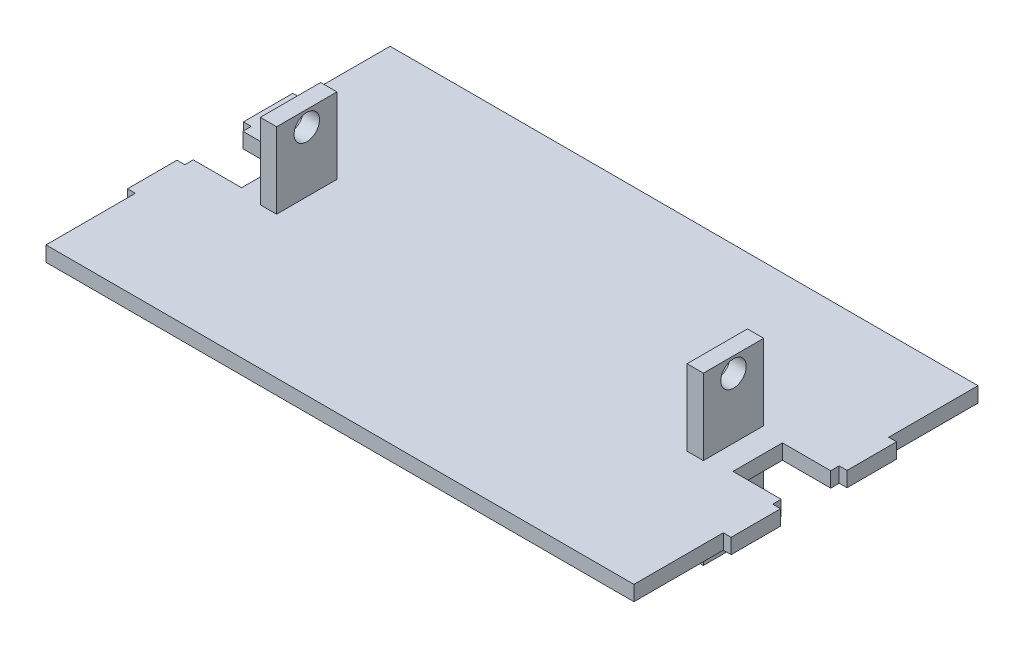
from build123d import *

# Parameters (mm, degrees)
BOSS_EXTRUDE1_DEPTH     = 3.175
SKETCH2_W               = 6.858
SKETCH2_H               = 25.4
BOSS_EXTRUDE2_DEPTH     = 35.052
CUT_EXTRUDE1_DEPTH      = 235.445990215
CUT_EXTRUDE1_DEPTH_BACK = 235.445990215
SKETCH3_R               = 5.3578125


with BuildPart() as part:
    # Sketch1 → Boss-Extrude1 (new, symmetric)
    with BuildSketch(Plane(origin=(0, 0, 0), x_dir=(1, 0, 0), z_dir=(0, 1, 0))):
        Polygon((123.698, -72.39), (-123.698, -72.39), (-123.698, -34.798), (-127, -34.798), (-127, -13.97), (-123.698, -13.97), (-123.698, -10.414), (-103.378, -10.414), (-103.378, 10.414), (-123.698, 10.414), (-123.698, 13.97), (-127, 13.97), (-127, 34.798), (-123.698, 34.798), (-123.698, 72.39), (123.698, 72.39), (123.698, 34.798), (127, 34.798), (127, 13.97), (123.698, 13.97), (123.698, 10.414), (103.378, 10.414), (103.378, -10.414), (123.698, -10.414), (123.698, -13.97), (127, -13.97), (127, -34.798), (123.698, -34.798), align=None)
    extrude(amount=BOSS_EXTRUDE1_DEPTH, both=True)

    # Sketch2 → Boss-Extrude2 (add, symmetric)
    with BuildSketch(Plane(origin=(0, 0, 0), x_dir=(1, 0, 0), z_dir=(0, 1, 0))):
        with Locations((89.789, 0)):
            Rectangle(SKETCH2_W, SKETCH2_H)
        with Locations((-89.789, 0)):
            Rectangle(SKETCH2_W, SKETCH2_H)
    extrude(amount=BOSS_EXTRUDE2_DEPTH, both=True)

    # Sketch3 → Cut-Extrude1 (cut, two sides: drawn at the far end of the back side and taken through both)
    with BuildSketch(Plane.ZY.offset(93.218).offset(-CUT_EXTRUDE1_DEPTH_BACK)):
        with Locations((0, 28.575)):
            Circle(SKETCH3_R)
        with Locations((0, -28.575)):
            Circle(SKETCH3_R)
    extrude(amount=CUT_EXTRUDE1_DEPTH + CUT_EXTRUDE1_DEPTH_BACK, mode=Mode.SUBTRACT)


solid = part.part
